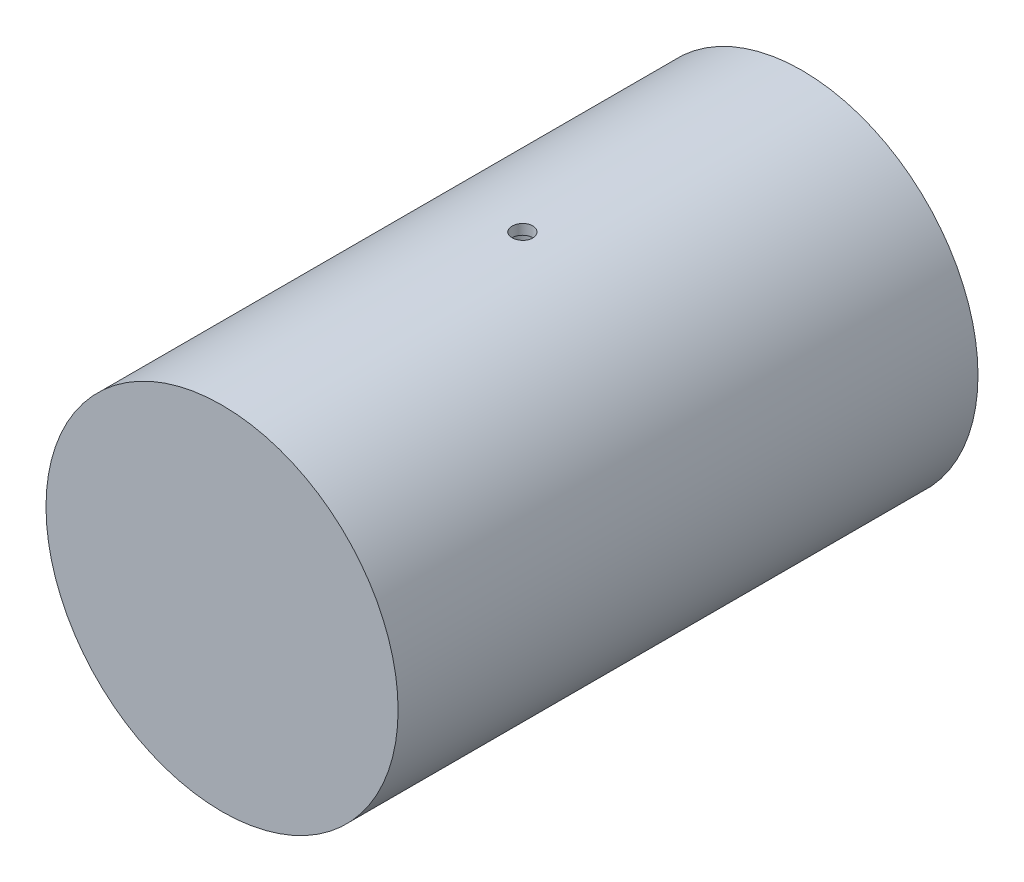
from build123d import *

# Parameters (mm, degrees)
FACE_2_R                      = 17
BOSS_EXTRUDE5_DEPTH           = 2
BOSS_EXTRUDE6_START           = -56
BOSS_EXTRUDE6_OUTLINE_R       = 17
BOSS_EXTRUDE6_OUTLINE_R_2     = 10
BOSS_EXTRUDE6_DEPTH           = 54
DRIVER_PIN_BODY_CUT_START     = 9.886859906
DRIVER_PIN_BODY_CUT_OUTLINE_R = 1.5
DRIVER_PIN_BODY_CUT_DEPTH     = 6.113140094
SKETCH5_R                     = 10
SKETCH5_R_2                   = 5
BOSS_EXTRUDE7_DEPTH           = 2
DRIVER_PIN_SKETCH_R           = 1
DRIVER_PIN_SKETCH_R_2         = 0.15
DRIVER_PIN_NECK_EXTRUDE_DEPTH = 1
SKETCH5_6_R                   = 5
SKETCH5_6_R_2                 = 2
CUT_EXTRUDE1_DEPTH            = 1


# Read off the part's stored shape, not the designer's step: Boss-Extrude6, driver_pin_body_cut
with BuildPart() as part:
    # face 2 → Boss-Extrude5 (new body)
    with BuildSketch(Plane.XY):
        Circle(FACE_2_R)
    extrude(amount=-BOSS_EXTRUDE5_DEPTH)

    # Boss-Extrude6 outline → Boss-Extrude6 (add)
    with BuildSketch(Plane.XY.offset(BOSS_EXTRUDE6_START)):
        Circle(BOSS_EXTRUDE6_OUTLINE_R)
        Circle(BOSS_EXTRUDE6_OUTLINE_R_2, mode=Mode.SUBTRACT)
    extrude(amount=BOSS_EXTRUDE6_DEPTH)

    # driver_pin_body_cut outline → driver_pin_body_cut (cut)
    with BuildSketch(Plane(origin=(0, 0, 0), x_dir=(1, 0, 0), z_dir=(0, 1, 0)).offset(DRIVER_PIN_BODY_CUT_START)):
        with Locations((0, 29)):
            Circle(DRIVER_PIN_BODY_CUT_OUTLINE_R)
    extrude(amount=DRIVER_PIN_BODY_CUT_DEPTH, mode=Mode.SUBTRACT)

    # Sketch5 → Boss-Extrude7 (add)
    with BuildSketch(Plane(origin=(0, 0, -56), x_dir=(-1, 0, 0), z_dir=(0, 0, -1))):
        with Locations(Location((0, 0, 0), (0, 0, 180))):
            Circle(SKETCH5_R)
        Circle(SKETCH5_R_2, mode=Mode.SUBTRACT)
    extrude(amount=-BOSS_EXTRUDE7_DEPTH)

    # driver_pin_sketch → driver_pin_neck_extrude (cut)
    # profile 1 of 2: a face of its own
    with BuildSketch(Plane(origin=(0, 17, 0), x_dir=(1, 0, 0), z_dir=(0, 1, 0))):
        with Locations(Location((0, 29, 0), (0, 0, 270))):
            Circle(DRIVER_PIN_SKETCH_R)
        with Locations((0, 29)):
            Circle(DRIVER_PIN_SKETCH_R_2, mode=Mode.SUBTRACT)
    # profile 2 of 2: a face of its own
    with BuildSketch(Plane(origin=(0, 17, 0), x_dir=(1, 0, 0), z_dir=(0, 1, 0))):
        with Locations((0, 29)):
            Circle(DRIVER_PIN_SKETCH_R_2)
    extrude(amount=-DRIVER_PIN_NECK_EXTRUDE_DEPTH, mode=Mode.SUBTRACT)

    # Sketch5<6> → Cut-Extrude1 (cut)
    with BuildSketch(Plane(origin=(0, 0, -56), x_dir=(-1, 0, 0), z_dir=(0, 0, -1))):
        Circle(SKETCH5_6_R)
        with Locations((3.830222216, -3.213938048)):
            Circle(SKETCH5_6_R_2)
        with Locations((-3.830222216, -3.213938048)):
            Circle(SKETCH5_6_R_2)
        with Locations((0, 5)):
            Circle(SKETCH5_6_R_2)
    extrude(amount=-CUT_EXTRUDE1_DEPTH, mode=Mode.SUBTRACT)


solid = part.part
